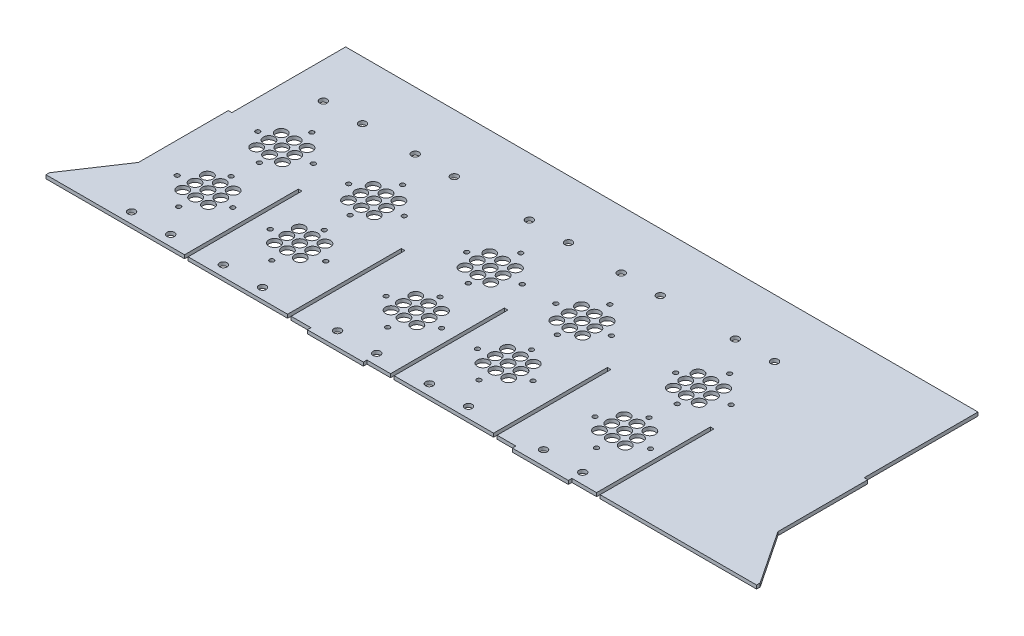
from build123d import *

# Parameters (mm, degrees)
SKETCH1_W            = 570.861
SKETCH1_H            = 3.175
BOSS_EXTRUDE1_DEPTH  = 232.6
SKETCH6_W            = 50
SKETCH6_H            = 3.175
BOSS_EXTRUDE2_DEPTH  = 3.175
SKETCH2_W            = 3.175
SKETCH2_H            = 101.6
CUT_EXTRUDE5_DEPTH   = 371.230335845
BOSS_EXTRUDE3_DEPTH  = 3.175
SKETCH13_W           = 3.175
SKETCH13_H           = 101.6
CUT_EXTRUDE6_DEPTH   = 396.22575932
LPATTERN2_COUNT      = 5
LPATTERN2_PITCH      = 91.9550104
M6_CLEARANCE_HOLE1_D = 6.6
M6_CLEARANCE_HOLE2_D = 6.6
LPATTERN3_COUNT      = 3
LPATTERN3_PITCH      = 183.919999952
LPATTERN4_COUNT      = 2
LPATTERN4_PITCH      = 183.919999952
SKETCH20_R           = 2
CUT_EXTRUDE8_DEPTH   = 396.327709896
SKETCH21_R           = 5
CUT_EXTRUDE9_DEPTH   = 396.22575932
LPATTERN5_COUNT      = 3
LPATTERN5_PITCH      = 186
SKETCH22_R           = 5
CUT_EXTRUDE10_DEPTH  = 396.22575932
LPATTERN6_COUNT      = 2
LPATTERN6_PITCH      = 186


with BuildPart() as part:
    # Sketch1 → Boss-Extrude1 (new body)
    with BuildSketch(Plane.XY):
        Rectangle(SKETCH1_W, SKETCH1_H)
    extrude(amount=BOSS_EXTRUDE1_DEPTH)

    # Sketch6 → Boss-Extrude2 (add)
    with BuildSketch(Plane.XY.offset(232.6)):
        with Locations((127.26300405, 0)):
            Rectangle(SKETCH6_W, SKETCH6_H)
        with Locations((-55.6950692, 0)):
            Rectangle(SKETCH6_W, SKETCH6_H)
    extrude(amount=BOSS_EXTRUDE2_DEPTH)

    # Sketch2 → Cut-Extrude5 (cut, through all)
    with BuildSketch(Plane(origin=(0, 1.5875, 0), x_dir=(1, 0, 0), z_dir=(0, 1, 0))):
        with Locations((283.843, -50.8)):
            Rectangle(SKETCH2_W, SKETCH2_H)
        with Locations((-283.843, -50.8)):
            Rectangle(SKETCH2_W, SKETCH2_H)
    extrude(amount=-CUT_EXTRUDE5_DEPTH, mode=Mode.SUBTRACT)

    # Sketch12 → Boss-Extrude3 (add)
    with BuildSketch(Plane(origin=(0, 1.5875, 0), x_dir=(1, 0, 0), z_dir=(0, 1, 0))):
        Polygon((-317.1805, -232.6), (-285.4305, -232.6), (-285.4305, -181.8), (-317.1805, -229.425), align=None)
    boss_extrude3 = extrude(amount=-BOSS_EXTRUDE3_DEPTH)

    # Mirror1: Boss-Extrude3 across plane
    add(boss_extrude3.mirror(Plane(origin=(0, 0, 0), x_dir=(0, 0, 1), z_dir=(1, 0, 0))))

    # Sketch13 → Cut-Extrude6 (cut, through all)
    with BuildSketch(Plane.XZ.offset(1.5875)):
        with Locations((-191.8879896, 181.8)):
            Rectangle(SKETCH13_W, SKETCH13_H)
    cut_extrude6 = extrude(amount=-CUT_EXTRUDE6_DEPTH, mode=Mode.SUBTRACT)

    # LPattern2: Cut-Extrude6 ×5
    with Locations(*[(i * LPATTERN2_PITCH, 0, 0) for i in range(1, LPATTERN2_COUNT)]):
        add(cut_extrude6, mode=Mode.SUBTRACT)

    # M6 Clearance Hole1 (through all)
    with Locations(Plane(origin=(0, 1.5875, 0), x_dir=(1, 0, 0), z_dir=(0, 1, 0))):
        with Locations((-250.327997081, -223.075), (-215.402997081, -223.075), (-215.402997081, -51.825), (-250.327997081, -51.825)):
            m6_clearance_hole1 = Hole(M6_CLEARANCE_HOLE1_D / 2)

    # M6 Clearance Hole2 (through all)
    with Locations(Plane(origin=(0, 1.5875, 0), x_dir=(1, 0, 0), z_dir=(0, 1, 0))):
        with Locations((-168.370494162, -223.075), (-133.445494162, -223.075), (-168.370494162, -51.825), (-133.445494162, -51.825)):
            m6_clearance_hole2 = Hole(M6_CLEARANCE_HOLE2_D / 2)

    # LPattern3: M6 Clearance Hole1 ×3
    with Locations(*[(i * LPATTERN3_PITCH, 0, 0) for i in range(1, LPATTERN3_COUNT)]):
        add(m6_clearance_hole1, mode=Mode.SUBTRACT)

    # LPattern4: M6 Clearance Hole2 ×2
    with Locations(*[(i * LPATTERN4_PITCH, 0, 0) for i in range(1, LPATTERN4_COUNT)]):
        add(m6_clearance_hole2, mode=Mode.SUBTRACT)

    # Sketch20 → Cut-Extrude8 (cut, through all)
    with BuildSketch(Plane(origin=(0, 7.935000001, 0), x_dir=(1, 0, 0), z_dir=(0, 1, 0))):
        with Locations((-206.464860636, -104.637084158)):
            Circle(SKETCH20_R)
        with Locations((-231.250394541, -128.058151968)):
            Circle(SKETCH20_R)
        with Locations((-256.035928446, -104.637084158)):
            Circle(SKETCH20_R)
        with Locations((-231.250394541, -81.216016348)):
            Circle(SKETCH20_R)
        with Locations((-174.982578446, -174.6221)):
            Circle(SKETCH20_R)
        with Locations((-150.197044541, -198.04316781)):
            Circle(SKETCH20_R)
        with Locations((-150.197044541, -151.20103219)):
            Circle(SKETCH20_R)
        with Locations((-125.411510636, -174.6221)):
            Circle(SKETCH20_R)
        with Locations((-21.999097153, -174.6221)):
            Circle(SKETCH20_R)
        with Locations((-46.784631058, -198.04316781)):
            Circle(SKETCH20_R)
        with Locations((-46.784631058, -151.20103219)):
            Circle(SKETCH20_R)
        with Locations((-71.570164963, -174.6221)):
            Circle(SKETCH20_R)
        with Locations((-125.411510636, -104.637084158)):
            Circle(SKETCH20_R)
        with Locations((-150.197044541, -128.058151968)):
            Circle(SKETCH20_R)
        with Locations((-174.982578446, -104.637084158)):
            Circle(SKETCH20_R)
        with Locations((-150.197044541, -81.216016348)):
            Circle(SKETCH20_R)
        with Locations((-208.499097153, -174.6221)):
            Circle(SKETCH20_R)
        with Locations((-233.284631058, -198.04316781)):
            Circle(SKETCH20_R)
        with Locations((-258.070164963, -174.6221)):
            Circle(SKETCH20_R)
        with Locations((-233.284631058, -151.20103219)):
            Circle(SKETCH20_R)
        with Locations((-44.750394541, -128.058151968)):
            Circle(SKETCH20_R)
        with Locations((-19.964860636, -104.637084158)):
            Circle(SKETCH20_R)
        with Locations((-44.750394541, -81.216016348)):
            Circle(SKETCH20_R)
        with Locations((-69.535928446, -104.637084158)):
            Circle(SKETCH20_R)
        with Locations((34.802955459, -198.04316781)):
            Circle(SKETCH20_R)
        with Locations((59.588489364, -174.6221)):
            Circle(SKETCH20_R)
        with Locations((34.802955459, -151.20103219)):
            Circle(SKETCH20_R)
        with Locations((10.017421554, -174.6221)):
            Circle(SKETCH20_R)
        with Locations((34.802955459, -128.058151968)):
            Circle(SKETCH20_R)
        with Locations((10.017421554, -104.637084158)):
            Circle(SKETCH20_R)
        with Locations((59.588489364, -104.637084158)):
            Circle(SKETCH20_R)
        with Locations((34.802955459, -81.216016348)):
            Circle(SKETCH20_R)
        with Locations((139.715368942, -198.04316781)):
            Circle(SKETCH20_R)
        with Locations((114.929835037, -174.6221)):
            Circle(SKETCH20_R)
        with Locations((164.500902847, -174.6221)):
            Circle(SKETCH20_R)
        with Locations((139.715368942, -151.20103219)):
            Circle(SKETCH20_R)
        with Locations((166.535139364, -104.637084158)):
            Circle(SKETCH20_R)
        with Locations((141.749605459, -128.058151968)):
            Circle(SKETCH20_R)
        with Locations((116.964071554, -104.637084158)):
            Circle(SKETCH20_R)
        with Locations((141.749605459, -81.216016348)):
            Circle(SKETCH20_R)
    extrude(amount=-CUT_EXTRUDE8_DEPTH, mode=Mode.SUBTRACT)

    # Sketch21 → Cut-Extrude9 (cut, through all)
    with BuildSketch(Plane(origin=(0, 1.5875, 0), x_dir=(1, 0, 0), z_dir=(0, 1, 0))):
        with Locations((-232.865497081, -95.343337061)):
            Circle(SKETCH21_R)
        with Locations((-244.365497081, -95.343337061)):
            Circle(SKETCH21_R)
        with Locations((-244.365497081, -106.343337061)):
            Circle(SKETCH21_R)
        with Locations((-244.365497081, -117.343337061)):
            Circle(SKETCH21_R)
        with Locations((-221.365497081, -106.343337061)):
            Circle(SKETCH21_R)
        with Locations((-232.865497081, -106.343337061)):
            Circle(SKETCH21_R)
        with Locations((-232.865497081, -117.343337061)):
            Circle(SKETCH21_R)
        with Locations((-221.365497081, -117.343337061)):
            Circle(SKETCH21_R)
        with Locations((-221.365497081, -95.343337061)):
            Circle(SKETCH21_R)
        with Locations((-244.365497081, -183.343337061)):
            Circle(SKETCH21_R)
        with Locations((-232.865497081, -183.343337061)):
            Circle(SKETCH21_R)
        with Locations((-221.365497081, -183.343337061)):
            Circle(SKETCH21_R)
        with Locations((-221.365497081, -172.343337061)):
            Circle(SKETCH21_R)
        with Locations((-221.365497081, -161.343337061)):
            Circle(SKETCH21_R)
        with Locations((-232.865497081, -161.343337061)):
            Circle(SKETCH21_R)
        with Locations((-232.865497081, -172.343337061)):
            Circle(SKETCH21_R)
        with Locations((-244.365497081, -172.343337061)):
            Circle(SKETCH21_R)
        with Locations((-244.365497081, -161.343337061)):
            Circle(SKETCH21_R)
    cut_extrude9 = extrude(amount=-CUT_EXTRUDE9_DEPTH, mode=Mode.SUBTRACT)

    # LPattern5: Cut-Extrude9 ×3
    with Locations(*[(i * LPATTERN5_PITCH, 0, 0) for i in range(1, LPATTERN5_COUNT)]):
        add(cut_extrude9, mode=Mode.SUBTRACT)

    # Sketch22 → Cut-Extrude10 (cut, through all)
    with BuildSketch(Plane(origin=(0, 1.5875, 0), x_dir=(1, 0, 0), z_dir=(0, 1, 0))):
        with Locations((-139.407994162, -117.343337061)):
            Circle(SKETCH22_R)
        with Locations((-150.907994162, -117.343337061)):
            Circle(SKETCH22_R)
        with Locations((-162.407994162, -117.343337061)):
            Circle(SKETCH22_R)
        with Locations((-162.407994162, -106.343337061)):
            Circle(SKETCH22_R)
        with Locations((-150.907994162, -106.343337061)):
            Circle(SKETCH22_R)
        with Locations((-139.407994162, -106.343337061)):
            Circle(SKETCH22_R)
        with Locations((-139.407994162, -95.343337061)):
            Circle(SKETCH22_R)
        with Locations((-150.907994162, -95.343337061)):
            Circle(SKETCH22_R)
        with Locations((-162.407994162, -95.343337061)):
            Circle(SKETCH22_R)
        with Locations((-139.407994162, -183.343337061)):
            Circle(SKETCH22_R)
        with Locations((-139.407994162, -172.343337061)):
            Circle(SKETCH22_R)
        with Locations((-139.407994162, -161.343337061)):
            Circle(SKETCH22_R)
        with Locations((-150.907994162, -161.343337061)):
            Circle(SKETCH22_R)
        with Locations((-150.907994162, -172.343337061)):
            Circle(SKETCH22_R)
        with Locations((-150.907994162, -183.343337061)):
            Circle(SKETCH22_R)
        with Locations((-162.407994162, -183.343337061)):
            Circle(SKETCH22_R)
        with Locations((-162.407994162, -172.343337061)):
            Circle(SKETCH22_R)
        with Locations((-162.407994162, -161.343337061)):
            Circle(SKETCH22_R)
    cut_extrude10 = extrude(amount=-CUT_EXTRUDE10_DEPTH, mode=Mode.SUBTRACT)

    # LPattern6: Cut-Extrude10 ×2
    with Locations(*[(i * LPATTERN6_PITCH, 0, 0) for i in range(1, LPATTERN6_COUNT)]):
        add(cut_extrude10, mode=Mode.SUBTRACT)


solid = part.part
